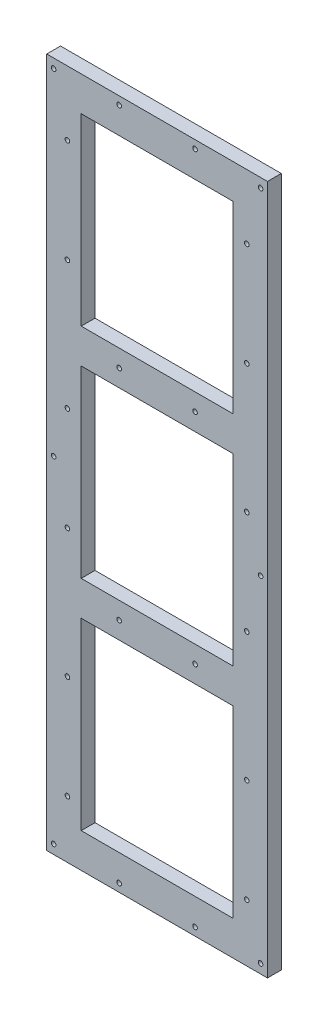
from build123d import *

# Parameters (mm, degrees)
SKETCH1_W           = 96
SKETCH1_H           = 300
SKETCH1_W_2         = 66
SKETCH1_H_2         = 80
BOSS_EXTRUDE1_DEPTH = 6
SKETCH3_R           = 1
CUT_EXTRUDE6_DEPTH  = 10
SKETCH2_R           = 1
CUT_EXTRUDE7_DEPTH  = 10
SKETCH4_R           = 1
CUT_EXTRUDE8_DEPTH  = 10


with BuildPart() as part:
    # Sketch1 → Boss-Extrude1 (new body)
    with BuildSketch(Plane.XY):
        with Locations((0, 6)):
            Rectangle(SKETCH1_W, SKETCH1_H)
        with Locations((0, 101)):
            Rectangle(SKETCH1_W_2, SKETCH1_H_2, mode=Mode.SUBTRACT)
        with Locations((0, -89)):
            Rectangle(SKETCH1_W_2, SKETCH1_H_2, mode=Mode.SUBTRACT)
        with Locations((0, 6)):
            Rectangle(SKETCH1_W_2, SKETCH1_H_2, mode=Mode.SUBTRACT)
    extrude(amount=BOSS_EXTRUDE1_DEPTH)

    # Sketch3 → Cut-Extrude6 (cut)
    with BuildSketch(Plane.XY.offset(6)):
        with Locations((-39, 128)):
            Circle(SKETCH3_R)
        with Locations((-16.5, 152.5)):
            Circle(SKETCH3_R)
        with Locations((16.5, 152.5)):
            Circle(SKETCH3_R)
        with Locations((-16.5, 53.5)):
            Circle(SKETCH3_R)
        with Locations((16.5, 53.5)):
            Circle(SKETCH3_R)
        with Locations((-39, 27)):
            Circle(SKETCH3_R)
        with Locations((39, 128)):
            Circle(SKETCH3_R)
        with Locations((39, 83)):
            Circle(SKETCH3_R)
        with Locations((-39, 83)):
            Circle(SKETCH3_R)
        with Locations((39, 27)):
            Circle(SKETCH3_R)
        with Locations((39, -18)):
            Circle(SKETCH3_R)
        with Locations((-39, -18)):
            Circle(SKETCH3_R)
        with Locations((-39, -74)):
            Circle(SKETCH3_R)
        with Locations((39, -74)):
            Circle(SKETCH3_R)
        with Locations((39, -119)):
            Circle(SKETCH3_R)
        with Locations((-39, -119)):
            Circle(SKETCH3_R)
    extrude(amount=-CUT_EXTRUDE6_DEPTH, mode=Mode.SUBTRACT)

    # Sketch2 → Cut-Extrude7 (cut)
    with BuildSketch(Plane.XY.offset(6)):
        with Locations((-45, 152)):
            Circle(SKETCH2_R)
        with Locations((45, 152)):
            Circle(SKETCH2_R)
        with Locations((-45, 6)):
            Circle(SKETCH2_R)
        with Locations((45, 6)):
            Circle(SKETCH2_R)
        with Locations((-45, -140)):
            Circle(SKETCH2_R)
        with Locations((45, -140)):
            Circle(SKETCH2_R)
    extrude(amount=-CUT_EXTRUDE7_DEPTH, mode=Mode.SUBTRACT)

    # Sketch4 → Cut-Extrude8 (cut)
    with BuildSketch(Plane.XY.offset(6)):
        with Locations((16.5, -41.5)):
            Circle(SKETCH4_R)
        with Locations((-16.5, -41.5)):
            Circle(SKETCH4_R)
        with Locations((16.5, 152.5)):
            Circle(SKETCH4_R)
        with Locations((-16.5, 152.5)):
            Circle(SKETCH4_R)
        with Locations((-16.5, 53.5)):
            Circle(SKETCH4_R)
        with Locations((16.5, 53.5)):
            Circle(SKETCH4_R)
        with Locations((-16.5, -140.5)):
            Circle(SKETCH4_R)
        with Locations((16.5, -140.5)):
            Circle(SKETCH4_R)
    extrude(amount=-CUT_EXTRUDE8_DEPTH, mode=Mode.SUBTRACT)


solid = part.part
